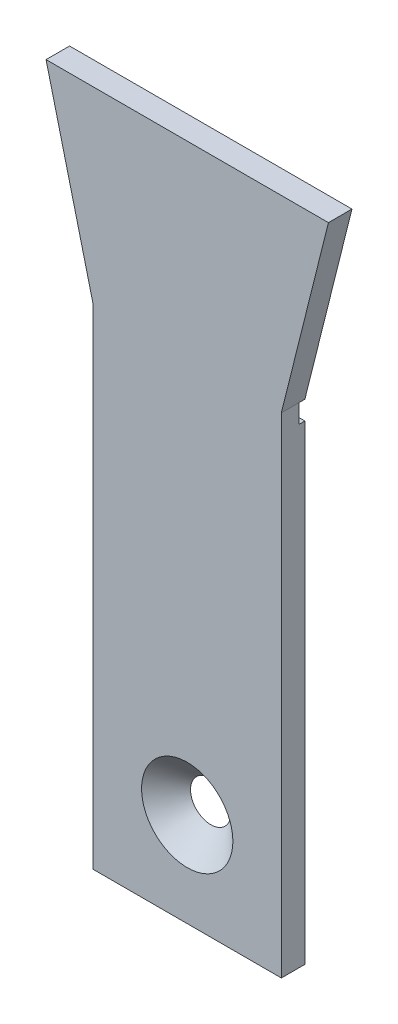
from build123d import *

# Parameters (mm, degrees)
DODANIE_WYCI_GNI_CIE1_DEPTH = 2.5
SZKIC2_W                    = 20
SZKIC2_H                    = 2
WYTNIJ_WYCI_GNI_CIE1_DEPTH  = 0.6
SZKIC3_R                    = 2.15
WYTNIJ_WYCI_GNI_CIE2_DEPTH  = 74.588382235
SFAZOWANIE1_SIZE2           = 2.5
SFAZOWANIE1_SIZE            = 2.7


with BuildPart() as part:
    # Szkic1 → Dodanie-wyciągnięcie1 (new body)
    with BuildSketch(Plane.XY):
        Polygon((-10, 0), (10, 0), (10, 50), (10, 52), (15, 72), (-15, 72), (-10, 52), (-10, 50), align=None)
    extrude(amount=DODANIE_WYCI_GNI_CIE1_DEPTH)

    # Szkic2 → Wytnij-wyciągnięcie1 (cut)
    with BuildSketch(Plane.XY):
        with Locations((0, 51)):
            Rectangle(SZKIC2_W, SZKIC2_H)
    extrude(amount=WYTNIJ_WYCI_GNI_CIE1_DEPTH, mode=Mode.SUBTRACT)

    # Szkic3 → Wytnij-wyciągnięcie2 (cut, through all)
    with BuildSketch(Plane.XY.offset(2.5)):
        with Locations((0, 10)):
            Circle(SZKIC3_R)
    extrude(amount=-WYTNIJ_WYCI_GNI_CIE2_DEPTH, mode=Mode.SUBTRACT)

    # Sfazowanie1
    sfazowanie1_edges = [part.edges().sort_by_distance(p)[0] for p in [
        (-2.15, 10, 2.5),
    ]]
    sfazowanie1_side = [part.faces().sort_by_distance(p)[0] for p in [
        (-2.2, 10, 2.5),
    ]]
    chamfer(sfazowanie1_edges, length=SFAZOWANIE1_SIZE - 0.0001, length2=SFAZOWANIE1_SIZE2 - 0.0001, reference=sfazowanie1_side[0])  # a hair under: the kernel refuses the full size


solid = part.part
